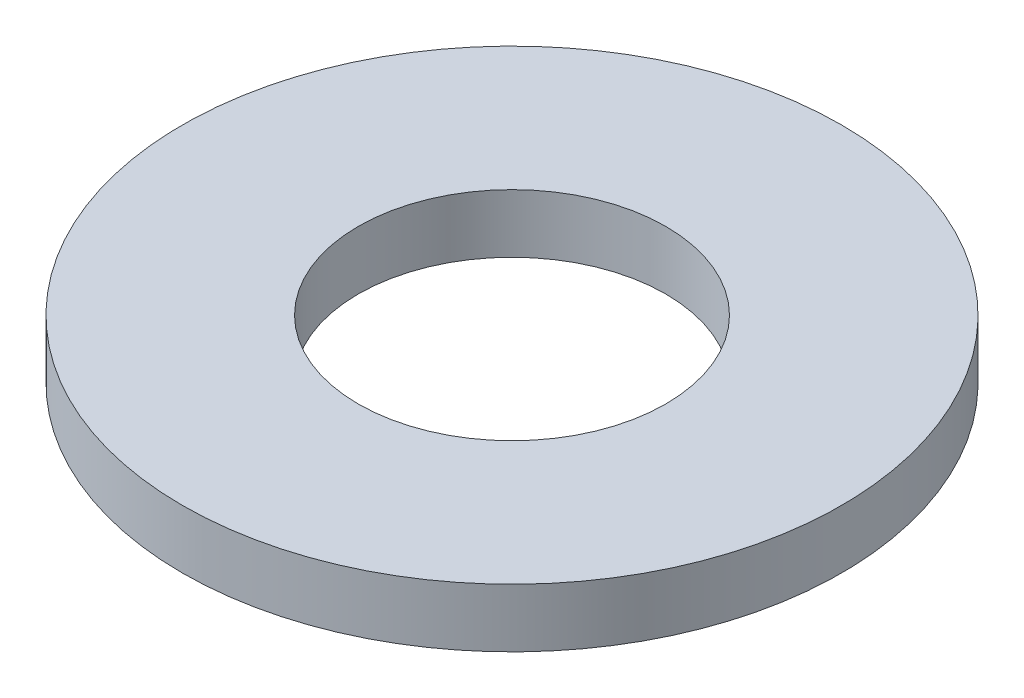
from build123d import *

# Parameters (mm, degrees)
SKETCH1_R           = 4.5
SKETCH1_R_2         = 2.1
BOSS_EXTRUDE1_DEPTH = 0.8


with BuildPart() as part:
    # Sketch1 → Boss-Extrude1 (new body)
    with BuildSketch(Plane(origin=(0, 0, 0), x_dir=(1, 0, 0), z_dir=(0, 1, 0))):
        Circle(SKETCH1_R)
        Circle(SKETCH1_R_2, mode=Mode.SUBTRACT)
    extrude(amount=BOSS_EXTRUDE1_DEPTH)


solid = part.part
